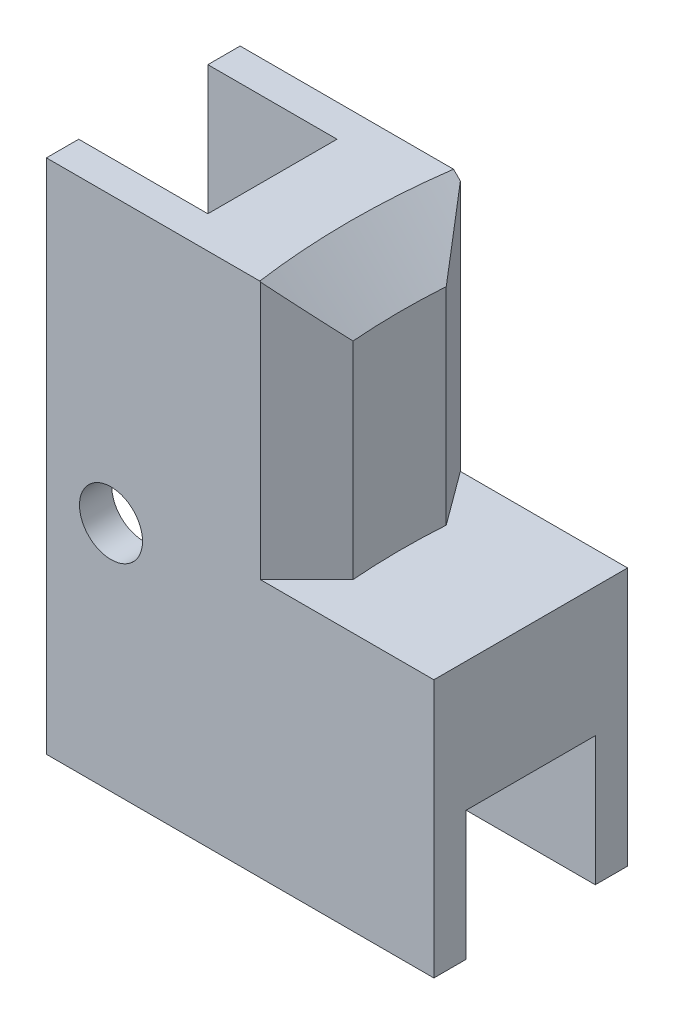
from build123d import *

# Parameters (mm, degrees)
BOSS_EXTRUDE1_DEPTH = 4.7625
CUT_EXTRUDE1_DEPTH  = 3.175
FILLET1_R           = 3.302
SKETCH3_R           = 31.75
CUT_EXTRUDE2_DEPTH  = 12.7
CHAMFER1_SIZE       = 2.23064129
CHAMFER1_SIZE_2     = 2.54
SKETCH4_R           = 1.55
CUT_EXTRUDE3_DEPTH  = 50.289254661


with BuildPart() as part:
    # Sketch1 → Boss-Extrude1 (new, symmetric)
    with BuildSketch(Plane.XY):
        Polygon((-44.45, 19.05), (-44.45, -6.35), (-25.4, -6.35), (-25.4, 6.35), (-28.575, 6.35), (-28.575, 19.05), align=None)
    extrude(amount=BOSS_EXTRUDE1_DEPTH, both=True)

    # Sketch2 → Cut-Extrude1 (cut, symmetric)
    with BuildSketch(Plane.XY):
        Polygon((-44.45, 19.05), (-38.1, 19.05), (-38.1, 0), (-25.4, 0), (-25.4, -6.35), (-44.45, -6.35), align=None)
    extrude(amount=CUT_EXTRUDE1_DEPTH, both=True, mode=Mode.SUBTRACT)

    # Fillet1
    fillet1_edges = [part.edges().sort_by_distance(p)[0] for p in [
        (-38.1, 0, 0),
    ]]
    fillet(fillet1_edges, radius=FILLET1_R)

    # Sketch3 → Cut-Extrude2 (cut)
    with BuildSketch(Plane(origin=(0, 19.05, 0), x_dir=(1, 0, 0), z_dir=(0, 1, 0))):
        Circle(SKETCH3_R)
    extrude(amount=-CUT_EXTRUDE2_DEPTH, mode=Mode.SUBTRACT)

    # Chamfer1
    # the kernel refuses this chamfer: 2.54, 2.23064129 mm, written as the material it takes off along each edge
    with BuildSketch(Plane(origin=(-31.390780394, 6.35, -4.7625), x_dir=(-1, 0, 0), z_dir=(0, 1, 0))) as chamfer1_piece_1:
        with BuildLine():
            Line((CHAMFER1_SIZE, 0), (0.288027051, 2.637492029))
            ThreePointArc((0.288027051, 2.637492029), (0.17562072, 1.352980867), (0, 0))
            Line((0, 0), (CHAMFER1_SIZE, 0))
        make_face()
    extrude(amount=19.52205078, mode=Mode.SUBTRACT)
    with BuildSketch(Plane(origin=(-31.390780394, 6.35, 4.7625), x_dir=(-0.11419845391674416, 0, -0.993457957400828), z_dir=(0, 1, 0))) as chamfer1_piece_2:
        with BuildLine():
            Line((2.293129868, 0), (CHAMFER1_SIZE_2 * 0.114198453917, CHAMFER1_SIZE_2 * 0.993457957401))
            Line((CHAMFER1_SIZE_2 * 0.114198453917, CHAMFER1_SIZE_2 * 0.993457957401), (0, 0))
            ThreePointArc((0, 0), (1.178209116, 0.020693522), (2.293129868, 0))
        make_face()
    extrude(amount=19.232074789, mode=Mode.SUBTRACT)
    with BuildSketch(Plane(origin=(0, 19.05, 0), x_dir=(-0.9371917542835735, 0, -0.34881458642504903), z_dir=(0.34881458642504903, 0, -0.9371917542835735))) as chamfer1_piece_3:
        Polygon((31.75, -CHAMFER1_SIZE_2), (31.75 + CHAMFER1_SIZE_2, 0), (31.75, 0), align=None)
    revolve(axis=Axis((0, 19.05, 0), (0, 1, 0)), revolution_arc=40.829654119, mode=Mode.SUBTRACT)

    # Sketch4 → Cut-Extrude3 (cut, through all)
    with BuildSketch(Plane.XY.offset(4.7625)):
        with Locations((-41.275, 5.08)):
            Circle(SKETCH4_R)
    extrude(amount=-CUT_EXTRUDE3_DEPTH, mode=Mode.SUBTRACT)


solid = part.part
